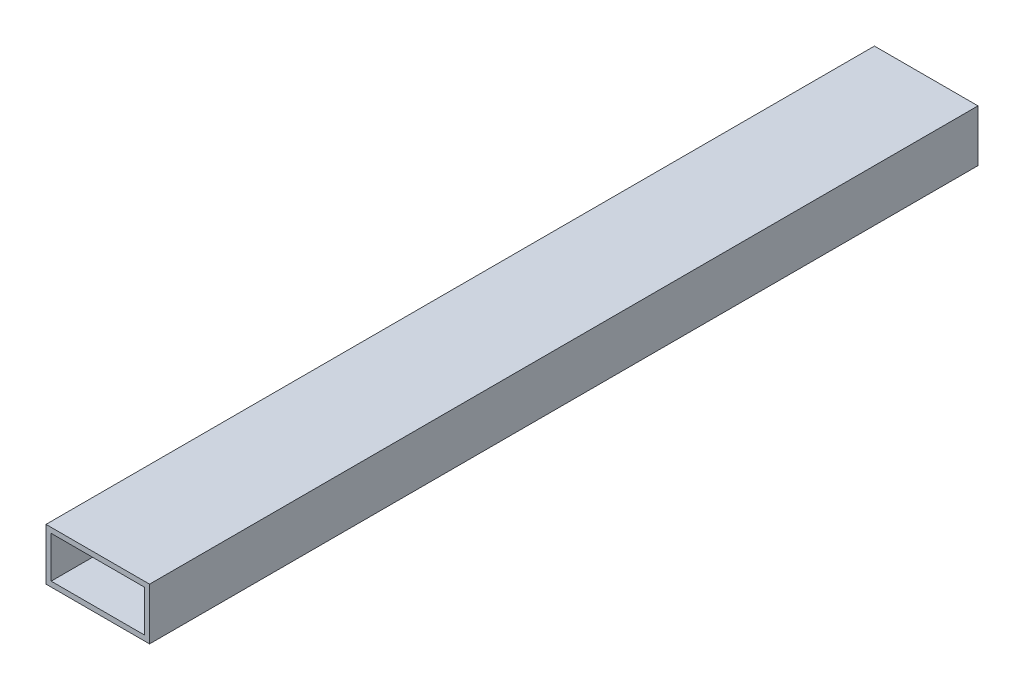
from build123d import *

# Parameters (mm, degrees)
SKETCH1_W           = 25.4
SKETCH1_H           = 12.7
BOSS_EXTRUDE1_DEPTH = 203.2
SKETCH4_W           = 22.86
SKETCH4_H           = 10.16
CUT_EXTRUDE1_DEPTH  = 204.695489641


with BuildPart() as part:
    # Sketch1 → Boss-Extrude1 (new body)
    with BuildSketch(Plane.XY):
        Rectangle(SKETCH1_W, SKETCH1_H)
    extrude(amount=BOSS_EXTRUDE1_DEPTH)

    # Sketch4 → Cut-Extrude1 (cut, through all)
    with BuildSketch(Plane(origin=(0, 0, 0), x_dir=(-1, 0, 0), z_dir=(0, 0, -1))):
        Rectangle(SKETCH4_W, SKETCH4_H)
    extrude(amount=-CUT_EXTRUDE1_DEPTH, mode=Mode.SUBTRACT)


solid = part.part
